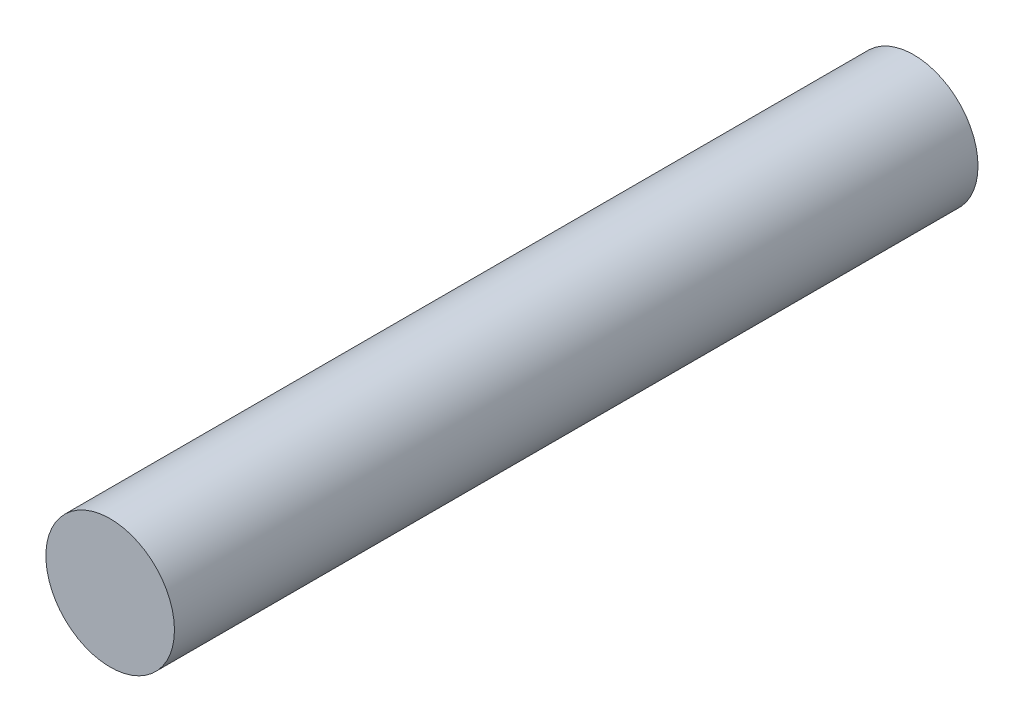
from build123d import *

# Parameters (mm, degrees)
SKETCH1_R           = 4
BOSS_EXTRUDE1_DEPTH = 50


with BuildPart() as part:
    # Sketch1 → Boss-Extrude1 (new body)
    with BuildSketch(Plane.XY):
        Circle(SKETCH1_R)
    extrude(amount=BOSS_EXTRUDE1_DEPTH)


solid = part.part
